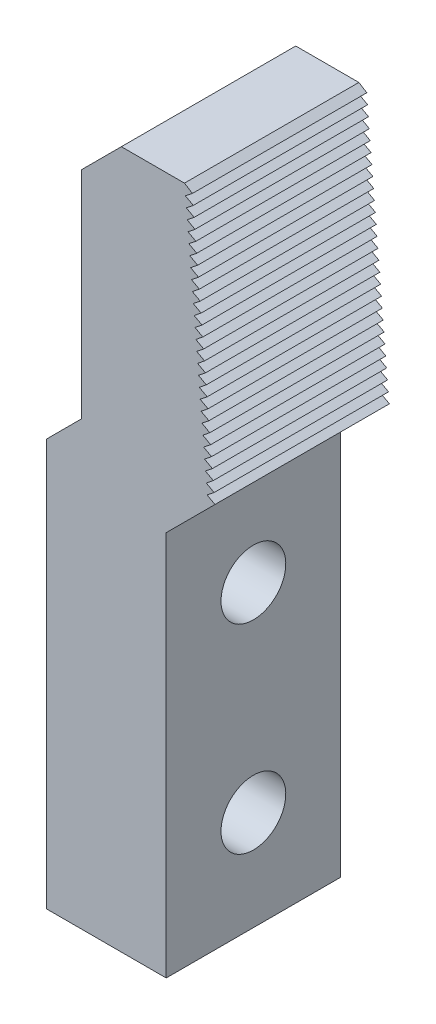
from build123d import *

# Parameters (mm, degrees)
EXTRUDE_1_DEPTH        = 35
CUT_EXTRUDE_28_DEPTH   = 49
CUT_EXTRUDE_29_DEPTH   = 178.259696491
CUT_EXTRUDE_30_DEPTH   = 49
PATTERN_LINEAR_1_COUNT = 26
PATTERN_LINEAR_1_PITCH = 2
CHAMFER_2_SIZE         = 3.4
SKETCH_54_W            = 35
SKETCH_54_H            = 30
CUT_EXTRUDE_33_DEPTH   = 50
CUT_EXTRUDE_34_DEPTH   = 110
CHAMFER_3_SIZE         = 15
SKETCH_61_R            = 6.5
CUT_EXTRUDE_37_DEPTH   = 100
CUT_EXTRUDE_38_DEPTH   = 177.82480109
CUT_EXTRUDE_39_DEPTH   = 177.82480109


with BuildPart() as part:
    # 草图48 → 拉伸1 (new body)
    with BuildSketch(Plane.XY):
        Polygon((34.1, 110), (36, 110), (36, 0), (0, 0), (-0.0001, 170), (34.1, 170), (34.1, 144.543002638), align=None)
    extrude(amount=EXTRUDE_1_DEPTH)

    # 草图49 → 切除-拉伸28 (cut)
    with BuildSketch(Plane.XY.offset(35)):
        Polygon((34.1, 113.69999995), (29.174388239, 170), (34.1, 170), align=None)
    extrude(amount=-CUT_EXTRUDE_28_DEPTH, mode=Mode.SUBTRACT)

    # 草图50 → 切除-拉伸29 (cut, through all)
    with BuildSketch(Plane.XY.offset(35)):
        Polygon((27.668658483, 170), (29.261543982, 169.003805302), (29.174388239, 170), align=None)
    extrude(amount=-CUT_EXTRUDE_29_DEPTH, mode=Mode.SUBTRACT)

    # 草图51 → 切除-拉伸30 (cut)
    with BuildSketch(Plane.XY.offset(35)):
        Polygon((27.854407685, 167.876876901), (29.261543982, 169.003805302), (29.435855467, 167.011415906), align=None)
    cut_extrude_30 = extrude(amount=-CUT_EXTRUDE_30_DEPTH, mode=Mode.SUBTRACT)

    # 阵列(线性)1: 切除-拉伸30 ×26
    with Locations(*[Vector(0.08715574274765898, -0.9961946980917455, 0) * (i * PATTERN_LINEAR_1_PITCH) for i in range(1, PATTERN_LINEAR_1_COUNT)]):
        add(cut_extrude_30, mode=Mode.SUBTRACT)

    # 倒角2
    # the kernel refuses this chamfer: 3.4 mm, written as the material it takes off along each edge
    with BuildSketch(Plane(origin=(36, 110, -8.743722159), x_dir=(-0.9996219169112966, 0.027495876610587885, 0), z_dir=(0, 0, 1))) as chamfer_2_piece_1_section:
        Polygon((CHAMFER_2_SIZE * 0.999621916911, CHAMFER_2_SIZE * 0.0274958766106), (-CHAMFER_2_SIZE * 0.0274958766106, CHAMFER_2_SIZE * 0.999621916911), (0, 0), align=None)
    chamfer_2_piece_1 = extrude(amount=52.487444318, mode=Mode.PRIVATE)
    chamfer_2_piece_1 = split(chamfer_2_piece_1, bisect_by=Plane(origin=(34.1, 108.700122697, 17.5), z_dir=(1, 0, 0)), keep=Keep.TOP, mode=Mode.PRIVATE)
    add(chamfer_2_piece_1, mode=Mode.SUBTRACT)

    # 草图54 → 切除-拉伸33 (cut)
    with BuildSketch(Plane(origin=(36, 0, 0), x_dir=(0, 0, -1), z_dir=(1, 0, 0))):
        with Locations((-17.5, 15)):
            Rectangle(SKETCH_54_W, SKETCH_54_H)
    extrude(amount=-CUT_EXTRUDE_33_DEPTH, mode=Mode.SUBTRACT)

    # 草图56 → 切除-拉伸34 (cut)
    with BuildSketch(Plane.XY.offset(35)):
        Polygon((29, 106.6), (33.793642605, 117.201681001), (59.324325826, 70.82967178), (36, 30), (29, 30), align=None)
    extrude(amount=-CUT_EXTRUDE_34_DEPTH, mode=Mode.SUBTRACT)

    # 倒角3
    chamfer_3_edges = [part.edges().sort_by_distance(p)[0] for p in [
        (-0.0001, 170, 17.5),
    ]]
    chamfer(chamfer_3_edges, length=CHAMFER_3_SIZE)

    # 草图61 → 切除-拉伸37 (cut)
    with BuildSketch(Plane(origin=(0, 0, 0), x_dir=(0, 0, 1), z_dir=(-0.9999999999998271, -5.882352941191543e-07, 0))):
        with Locations(Location((17.5, 50, 0), (0, 0, 270))):
            Circle(SKETCH_61_R)
        with Locations(Location((17.5, 90, 0), (0, 0, 270))):
            Circle(SKETCH_61_R)
    extrude(amount=-CUT_EXTRUDE_37_DEPTH, mode=Mode.SUBTRACT)

    # 草图62 → 切除-拉伸38 (cut, through all)
    with BuildSketch(Plane.XY.offset(35)):
        Polygon((33.793642605, 117.201681001), (24, 107.408038396), (24, 30), (29, 30), (29, 106.6), align=None)
    extrude(amount=-CUT_EXTRUDE_38_DEPTH, mode=Mode.SUBTRACT)

    # 草图63 → 切除-拉伸39 (cut, through all)
    with BuildSketch(Plane.XY.offset(35)):
        Polygon((-6.5701e-05, 111.692243943), (6.999930181, 118.692239825), (6.999930181, 179.62094854), (-6.5701e-05, 176.661572218), (-12.74320746, 177.391313792), (-12.74320746, 111.692243943), align=None)
    extrude(amount=-CUT_EXTRUDE_39_DEPTH, mode=Mode.SUBTRACT)


solid = part.part
